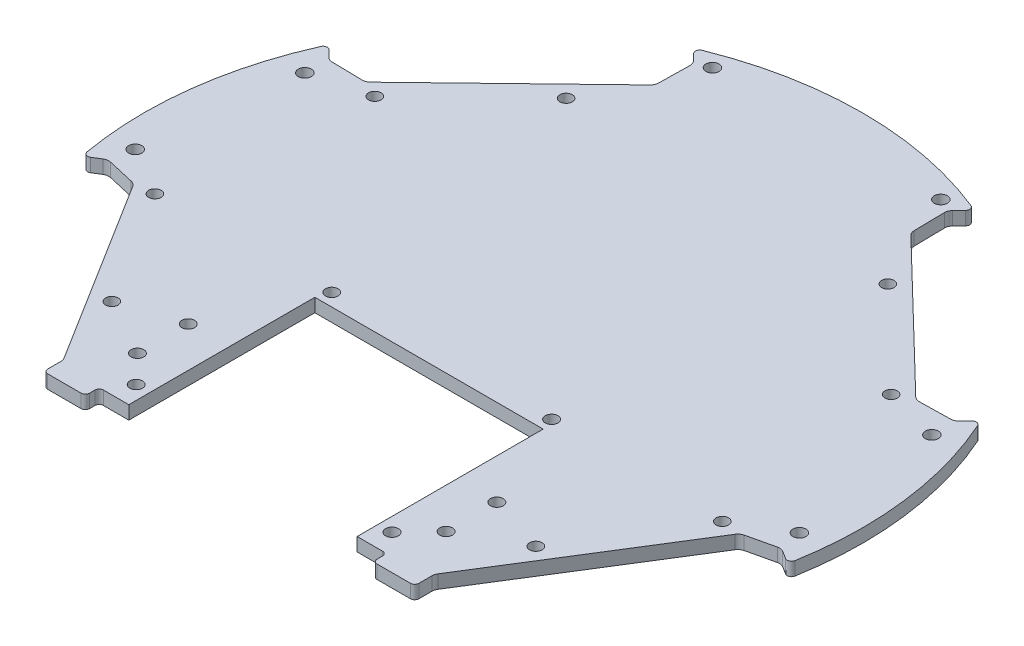
from build123d import *

# Parameters (mm, degrees)
BOSS_EXTRUDE4_DEPTH  = 1.5875
M3_CLEARANCE_HOLE3_D = 3
M3_CLEARANCE_HOLE1_D = 3.1
M3_CLEARANCE_HOLE4_D = 2.95
M3_CLEARANCE_HOLE2_D = 3.1
BOSS_EXTRUDE6_DEPTH  = 3.175
FILLET1_R            = 2
FILLET3_R            = 1
FILLET6_R            = 0.5
SKETCH28_W           = 54
SKETCH28_H           = 45
CUT_EXTRUDE4_DEPTH   = 10
CUT_EXTRUDE5_DEPTH   = 10
SKETCH31_R           = 1.5
CUT_EXTRUDE7_DEPTH   = 10


with BuildPart() as part:
    # Sketch1 → Boss-Extrude4 (new, symmetric)
    with BuildSketch(Plane(origin=(0, 0, 0), x_dir=(1, 0, 0), z_dir=(0, 1, 0))):
        with BuildLine():
            Line((-62.799553621, 32.496136604), (-73.969425011, 32.691107434))
            Line((-73.969425011, 32.691107434), (-77.053684287, 35.88495141))
            ThreePointArc((-77.053684287, 35.88495141), (-84.36642289, 10.358894189), (-83.446216027, -16.178041625))
            Line((-83.446216027, -16.178041625), (-79.680911643, -13.825218315))
            Line((-79.680911643, -13.825218315), (-69.484649137, -16.179210996))
            Line((-69.484649137, -16.179210996), (-43.894490772, -57.132025032))
            Line((-43.894490772, -57.132025032), (-43.894490772, -64.826600275))
            Line((-43.894490772, -64.826600275), (-43.094490772, -64.826600275))
            Line((-43.094490772, -64.826600275), (-34, -64.826600275))
            Line((-34, -64.826600275), (-34, -62.55))
            Line((-34, -62.55), (-34, -61.55))
            Line((-34, -61.55), (-20, -61.55))
            Line((-20, -61.55), (-19.859459165, -62.55))
            Line((-19.859459165, -62.55), (19.859459165, -62.55))
            Line((19.859459165, -62.55), (20, -61.55))
            Line((20, -61.55), (34, -61.55))
            Line((34, -61.55), (34, -62.55))
            Line((34, -62.55), (34, -64.826600275))
            Line((34, -64.826600275), (43.094490772, -64.826600275))
            Line((43.094490772, -64.826600275), (43.894490772, -64.826600275))
            Line((43.894490772, -64.826600275), (43.894490772, -57.132025032))
            Line((43.894490772, -57.132025032), (69.484649137, -16.179210996))
            Line((69.484649137, -16.179210996), (79.680911643, -13.825218315))
            Line((79.680911643, -13.825218315), (83.446216027, -16.178041625))
            ThreePointArc((83.446216027, -16.178041625), (84.610662337, -8.126242604), (85, 0))
            ThreePointArc((85, 0), (82.98964744, 18.377116688), (77.053684287, 35.88495141))
            Line((77.053684287, 35.88495141), (73.969425011, 32.691107434))
            Line((73.969425011, 32.691107434), (62.799553621, 32.496136604))
            Line((62.799553621, 32.496136604), (30.284668021, 63.895396642))
            Line((30.284668021, 63.895396642), (30.089697191, 75.065268032))
            Line((30.089697191, 75.065268032), (33.173956467, 78.259112008))
            ThreePointArc((33.173956467, 78.259112008), (0, 85), (-33.173956467, 78.259112008))
            Line((-33.173956467, 78.259112008), (-30.089697191, 75.065268032))
            Line((-30.089697191, 75.065268032), (-30.284668021, 63.895396642))
            Line((-30.284668021, 63.895396642), (-62.799553621, 32.496136604))
        make_face()
    extrude(amount=BOSS_EXTRUDE4_DEPTH, both=True)

    # M3 Clearance Hole3 (through all)
    with Locations(Plane(origin=(0, -1.5875, 0), x_dir=(-1, 0, 0), z_dir=(0, -1, 0))):
        with Locations((36.5, -50), (36.5, -38), (-36.5, -50), (-36.5, -38)):
            Hole(M3_CLEARANCE_HOLE3_D / 2)

    # M3 Clearance Hole1 (through all)
    with Locations(Plane(origin=(0, 1.5875, 0), x_dir=(1, 0, 0), z_dir=(0, 1, 0))):
        with Locations((-78.542321426, -8.49139241), (78.542321426, -8.49139241), (74.155025063, 27.240269049), (-74.155025063, 27.240269049)):
            Hole(M3_CLEARANCE_HOLE1_D / 2)

    # M3 Clearance Hole4 (through all)
    with Locations(Plane(origin=(0, -1.5875, 0), x_dir=(-1, 0, 0), z_dir=(0, -1, 0))):
        with Locations((-67.099301622, -15.278865202), (-50.141885166, -42.416404279), (-61.062544382, 30.698137949), (-38.043670771, 52.927205804), (50.141885166, -42.416404279), (67.099301622, -15.278865202), (38.043670771, 52.927205804), (61.062544382, 30.698137949)):
            Hole(M3_CLEARANCE_HOLE4_D / 2)

    # M3 Clearance Hole2 (through all)
    with Locations(Plane(origin=(0, 1.5875, 0), x_dir=(1, 0, 0), z_dir=(0, 1, 0))):
        with Locations((27, 76.497766718), (-27, 76.497766718)):
            Hole(M3_CLEARANCE_HOLE2_D / 2)

    # Sketch22 → Boss-Extrude6 (add)
    with BuildSketch(Plane(origin=(0, 1.5875, 0), x_dir=(1, 0, 0), z_dir=(0, 1, 0))):
        Polygon((65.061950694, 32.535626892), (30.245177733, 66.157793715), (30.284668021, 63.895396642), (62.799553621, 32.496136604), align=None)
        Polygon((-30.284668021, 63.895396642), (-30.245177733, 66.157793715), (-65.061950694, 32.535626892), (-62.799553621, 32.496136604), align=None)
        Polygon((43.894490772, -60.151352895), (71.689396914, -15.670204865), (69.484649137, -16.179210996), (43.894490772, -57.132025032), align=None)
        Polygon((-69.484649137, -16.179210996), (-71.689396914, -15.670204865), (-43.894490772, -60.151352895), (-43.894490772, -57.132025032), align=None)
    extrude(amount=-BOSS_EXTRUDE6_DEPTH)

    # Fillet1
    fillet1_edges = [part.edges().sort_by_distance(p)[0] for p in [
        (-30.245177733, 0.79375, -66.157793715),
        (-65.061950694, 0.79375, -32.535626892),
        (-71.689396914, 0.79375, 15.670204865),
        (-43.894490772, 0.79375, 60.151352895),
        (43.894490772, -0.79375, 60.151352895),
        (71.689396914, -0.79375, 15.670204865),
        (65.061950694, 0.79375, -32.535626892),
        (30.245177733, -0.79375, -66.157793715),
        (30.089697191, -0.79375, -75.065268032),
        (73.969425011, -0.79375, -32.691107434),
        (79.680911643, -0.79375, 13.825218315),
        (-79.680911643, -0.79375, 13.825218315),
        (-73.969425011, -0.79375, -32.691107434),
        (-30.089697191, -0.79375, -75.065268032),
    ]]
    fillet(fillet1_edges, radius=FILLET1_R)

    # Fillet3
    fillet3_edges = [part.edges().sort_by_distance(p)[0] for p in [
        (33.173956467, -0.79375, -78.259112008),
        (77.053684287, 0.79375, -35.88495141),
        (83.446216027, -0.79375, 16.178041625),
        (43.894490772, -0.79375, 64.826600275),
        (34, 0.79375, 64.826600275),
        (34, -0.79375, 61.55),
        (-34, -0.79375, 61.55),
        (-34, 0.79375, 64.826600275),
        (-43.894490772, -0.79375, 64.826600275),
        (-83.446216027, -0.79375, 16.178041625),
        (-77.053684287, -0.79375, -35.88495141),
        (-33.173956467, -0.79375, -78.259112008),
    ]]
    fillet(fillet3_edges, radius=FILLET3_R - 0.0001)  # a hair under: the kernel refuses the full size

    # Fillet6
    fillet6_edges = [part.edges().sort_by_distance(p)[0] for p in [
        (20, -0.79375, 61.55),
        (19.859459165, -0.79375, 62.55),
        (-19.859459165, 0.79375, 62.55),
        (-20, 0.79375, 61.55),
    ]]
    fillet(fillet6_edges, radius=FILLET6_R)

    # Sketch28 → Cut-Extrude4 (cut)
    with BuildSketch(Plane(origin=(0, 1.5875, 0), x_dir=(1, 0, 0), z_dir=(0, 1, 0))):
        with Locations((0, -40.05)):
            Rectangle(SKETCH28_W, SKETCH28_H)
    extrude(amount=-CUT_EXTRUDE4_DEPTH, mode=Mode.SUBTRACT)

    # Sketch29 → Cut-Extrude5 (cut)
    with BuildSketch(Plane(origin=(0, 1.5875, 0), x_dir=(1, 0, 0), z_dir=(0, 1, 0))):
        with BuildLine():
            ThreePointArc((-31.75, -56.55), (-30.25, -58.05), (-28.75, -56.55))
            Line((-28.75, -56.55), (-30.25, -56.55))
            Line((-30.25, -56.55), (-31.75, -56.55))
        make_face()
        with BuildLine():
            Line((-30.25, -56.55), (-28.75, -56.55))
            ThreePointArc((-28.75, -56.55), (-30.25, -55.05), (-31.75, -56.55))
            Line((-31.75, -56.55), (-30.25, -56.55))
        make_face()
        with BuildLine():
            ThreePointArc((28.75, -56.55), (30.25, -58.05), (31.75, -56.55))
            ThreePointArc((31.75, -56.55), (30.25, -55.05), (28.75, -56.55))
        make_face()
    extrude(amount=-CUT_EXTRUDE5_DEPTH, mode=Mode.SUBTRACT)

    # Sketch31 → Cut-Extrude7 (cut)
    with BuildSketch(Plane(origin=(0, 1.5875, 0), x_dir=(1, 0, 0), z_dir=(0, 1, 0))):
        with Locations(Location((-26, -14.55, 0), (0, 0, 270))):
            Circle(SKETCH31_R)
        with Locations(Location((26, -14.55, 0), (0, 0, 270))):
            Circle(SKETCH31_R)
    extrude(amount=-CUT_EXTRUDE7_DEPTH, mode=Mode.SUBTRACT)


solid = part.part
